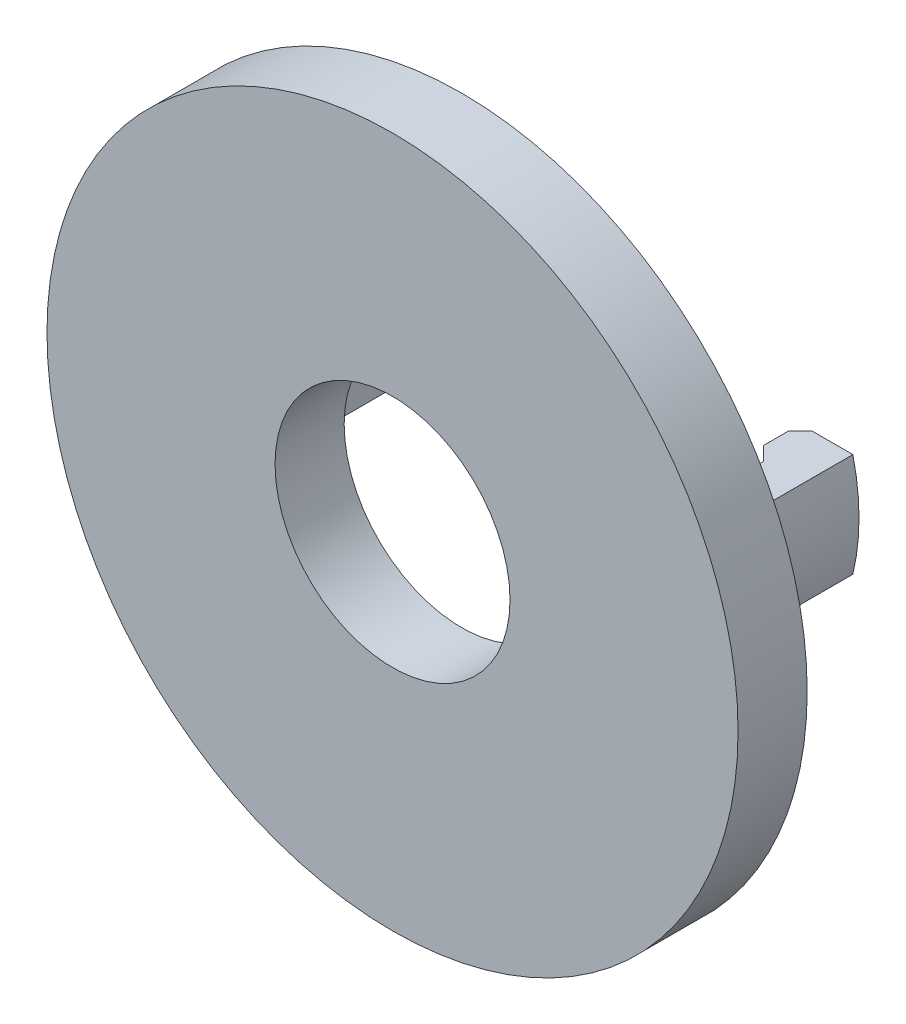
from build123d import *

# Parameters (mm, degrees)
GUARD_BASE_R           = 25
GUARD_DEPTH            = 5
INNER_AXLE_HOLE_BASE_R = 8.5
INNER_AXLE_HOLE_DEPTH  = 36.707142143
COUPLING_TOOTH_DEPTH   = 3.75
SKETCH6_4_W            = 9
SKETCH6_4_H            = 12.75


with BuildPart() as part:
    # Guard base → Guard (new body)
    with BuildSketch(Plane.XY):
        Circle(GUARD_BASE_R)
    extrude(amount=GUARD_DEPTH)

    # Inner axle hole base → Inner axle hole (cut, through all)
    with BuildSketch(Plane.XY.offset(5)):
        Circle(INNER_AXLE_HOLE_BASE_R)
    extrude(amount=-INNER_AXLE_HOLE_DEPTH, mode=Mode.SUBTRACT)

    # Coupling tooth base → Coupling tooth (add, symmetric)
    with BuildSketch(Plane(origin=(0, 0, 0), x_dir=(1, 0, 0), z_dir=(0, 1, 0))):
        Polygon((10.353553391, 0), (16, 0), (16, 12.75), (12.603553391, 12.75), (11.75, 11.896446609), (11.75, 10.103553391), (12.75, 9.103553391), (12.75, 2.396446609), align=None)
    coupling_tooth = extrude(amount=COUPLING_TOOTH_DEPTH, both=True)

    # Sketch6<4> → Circularity cut (revolve, cut)
    with BuildSketch(Plane(origin=(0, 0, 0), x_dir=(1, 0, 0), z_dir=(0, 1, 0))):
        with Locations((20.5, 6.375)):
            Rectangle(SKETCH6_4_W, SKETCH6_4_H)
    circularity_cut = revolve(axis=Axis((0, 0, 0), (0, 0, -1)), mode=Mode.SUBTRACT)

    # Coutpling teeth: Coupling tooth, Circularity cut across plane
    add(coupling_tooth.mirror(Plane(origin=(0, 0, 0), x_dir=(0, 0, 1), z_dir=(1, 0, 0))))
    add(circularity_cut.mirror(Plane(origin=(0, 0, 0), x_dir=(0, 0, 1), z_dir=(1, 0, 0))), mode=Mode.SUBTRACT)


solid = part.part
